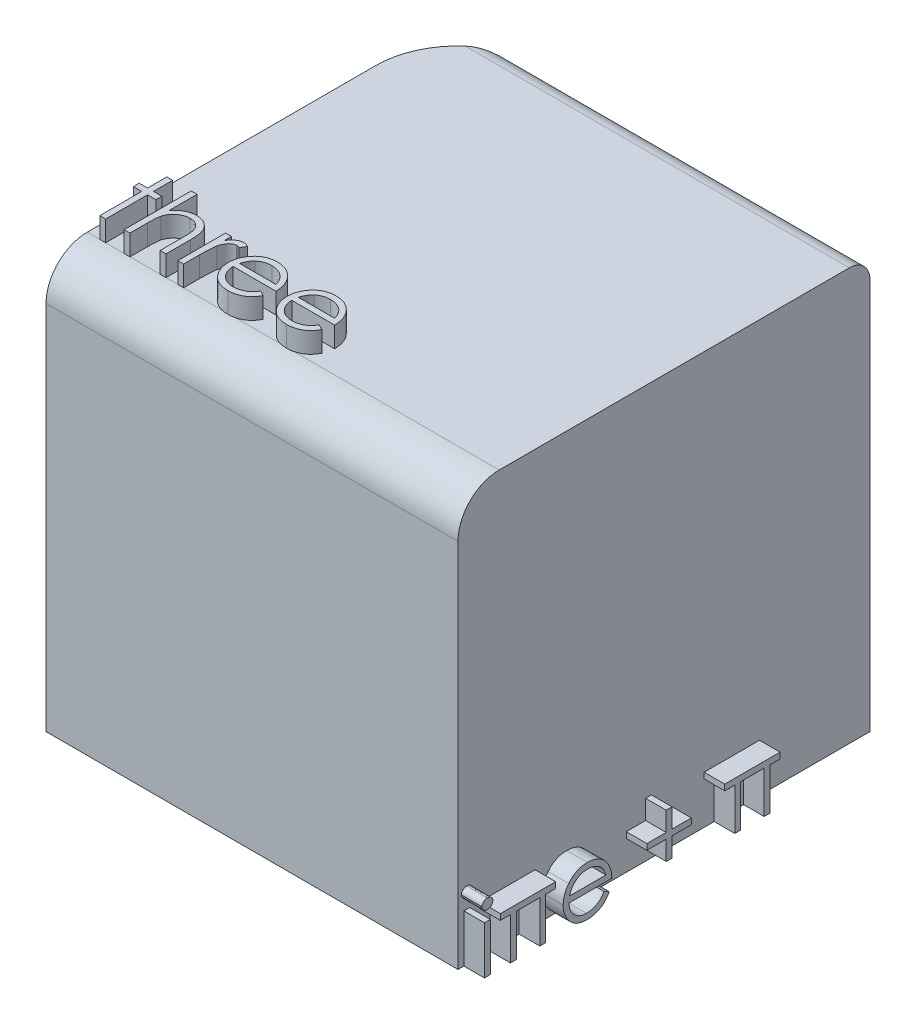
from build123d import *
from OCP.BRepFilletAPI import BRepFilletAPI_MakeFillet

# Parameters (mm, degrees)
SKETCH2_W           = 20
SKETCH2_H           = 20
BOSS_EXTRUDE1_DEPTH = 20
SKETCH3_W           = 0.284935898
SKETCH3_H           = 2.320192308
BOSS_EXTRUDE2_DEPTH = 1
FILLET1_R1          = 2
FILLET1_R2          = 1
FILLET1_R3          = 4
BOSS_EXTRUDE3_DEPTH = 1


with BuildPart() as part:
    # Sketch2 → Boss-Extrude1 (new body)
    with BuildSketch(Plane(origin=(0, 0, 0), x_dir=(1, 0, 0), z_dir=(0, 1, 0))):
        with Locations((10, -10)):
            Rectangle(SKETCH2_W, SKETCH2_H)
    extrude(amount=BOSS_EXTRUDE1_DEPTH)

    # Sketch3 → Boss-Extrude2 (add)
    # profile 1 of 6: a face of its own
    with BuildSketch(Plane(origin=(20, 0, 0), x_dir=(0, 0, -1), z_dir=(1, 0, 0))):
        with BuildLine():
            add(Edge.make_bspline(
                [(-19.573868189, 3.297115385), (-19.556186781, 3.296295189), (-19.521563189, 3.294689089), (-19.47149501, 3.280935463), (-19.425904721, 3.257622177), (-19.385466349, 3.226344181), (-19.350766423, 3.189560043), (-19.326472493, 3.146687593), (-19.310858391, 3.100370114), (-19.308972844, 3.06806214), (-19.308012821, 3.05161258)],
                knots=[0, 0, 0, 0, 1.055194115, 2.066272739, 3.074728998, 4.095836921, 5.109056067, 6.073838105, 7.019297344, 8, 8, 8, 8], degree=3))
            add(Edge.make_bspline(
                [(-19.308012821, 3.05161258), (-19.308994494, 3.03559003), (-19.310935147, 3.003915346), (-19.326460432, 2.958400839), (-19.350973462, 2.916124096), (-19.385444098, 2.879411381), (-19.425910617, 2.848150675), (-19.471493444, 2.824832805), (-19.521563601, 2.811080395), (-19.55618692, 2.809474127), (-19.573868189, 2.808653846)],
                knots=[0, 0, 0, 0, 0.96129708, 1.900370562, 2.859976407, 3.87933698, 4.906634145, 5.921202961, 6.938410037, 8, 8, 8, 8], degree=3))
            add(Edge.make_bspline(
                [(-19.573868189, 2.808653846), (-19.591347267, 2.809442807), (-19.625368009, 2.810978415), (-19.674686502, 2.825102646), (-19.71988806, 2.848158655), (-19.760405299, 2.879206694), (-19.794178403, 2.916349565), (-19.818760455, 2.958375039), (-19.834249885, 3.003921915), (-19.836195369, 3.035592237), (-19.837179487, 3.05161258)],
                knots=[0, 0, 0, 0, 1.054934014, 2.053291228, 3.073705704, 4.106921865, 5.123545215, 6.088680038, 7.033164197, 8, 8, 8, 8], degree=3))
            add(Edge.make_bspline(
                [(-19.837179487, 3.05161258), (-19.83621693, 3.068059851), (-19.834326407, 3.100363328), (-19.818748845, 3.146713822), (-19.794383162, 3.189332756), (-19.760382936, 3.226548745), (-19.719894012, 3.257614247), (-19.674684964, 3.280665637), (-19.625368416, 3.294791066), (-19.591347405, 3.296326509), (-19.573868189, 3.297115385)],
                knots=[0, 0, 0, 0, 0.98631895, 1.937192651, 2.907499808, 3.917963147, 4.944918757, 5.95915025, 6.951458133, 8, 8, 8, 8], degree=3))
        make_face()
    # profile 2 of 6: a face of its own
    with BuildSketch(Plane(origin=(20, 0, 0), x_dir=(0, 0, -1), z_dir=(1, 0, 0))):
        with Locations((-19.572596154, 1.160096154)):
            Rectangle(SKETCH3_W, SKETCH3_H)
    # profile 3 of 6: a face of its own
    with BuildSketch(Plane(origin=(20, 0, 0), x_dir=(0, 0, -1), z_dir=(1, 0, 0))):
        Polygon((-16.256585145, 2.03525641), (-16.745046683, 2.03525641), (-16.745046683, 0), (-17.029982581, 0), (-17.029982581, 2.03525641), (-18.169726171, 2.03525641), (-18.169726171, 0), (-18.454662068, 0), (-18.454662068, 2.03525641), (-18.943123606, 2.03525641), (-18.943123606, 2.320192308), (-16.256585145, 2.320192308), align=None)
    # profile 4 of 6: a face of its own
    with BuildSketch(Plane(origin=(20, 0, 0), x_dir=(0, 0, -1), z_dir=(1, 0, 0))):
        with BuildLine():
            Line((-13.909152811, 0.732692308), (-13.656017795, 0.599764623))
            add(Edge.make_bspline(
                [(-13.656017795, 0.599764623), (-13.676189563, 0.563983887), (-13.715435837, 0.494368744), (-13.782927944, 0.398726985), (-13.853677895, 0.312686557), (-13.930879352, 0.238546085), (-14.012222561, 0.1739109), (-14.098158612, 0.117361587), (-14.189134897, 0.069175501), (-14.285155718, 0.028578565), (-14.387027454, -0.002635762), (-14.494996972, -0.024683162), (-14.609271115, -0.038311413), (-14.687599435, -0.039894505), (-14.727707498, -0.040705128)],
                knots=[0, 0, 0, 0, 1.120438281, 2.179929193, 3.190490725, 4.156257408, 5.095198341, 6.022838206, 6.959905092, 7.901321166, 8.864066838, 9.862729781, 10.905609505, 12, 12, 12, 12], degree=3))
            add(Edge.make_bspline(
                [(-14.727707498, -0.040705128), (-14.772286292, -0.039664476), (-14.859246605, -0.037634466), (-14.985829089, -0.020133445), (-15.10500899, 0.008416481), (-15.216779607, 0.048299508), (-15.320867222, 0.100394295), (-15.417478712, 0.163857539), (-15.507122139, 0.238363227), (-15.586972671, 0.324556715), (-15.658858193, 0.416796776), (-15.722290902, 0.5129139), (-15.775320143, 0.612666254), (-15.818457153, 0.7154188), (-15.853295852, 0.820523904), (-15.877577076, 0.928937878), (-15.891574062, 1.040367301), (-15.893718952, 1.115748455), (-15.894799846, 1.153735978)],
                knots=[0, 0, 0, 0, 1.145258523, 2.234067595, 3.276747158, 4.290159414, 5.277019952, 6.260822364, 7.254936242, 8.264827045, 9.274100331, 10.257902744, 11.220704747, 12.172965371, 13.118907548, 14.062713208, 15.023725156, 16, 16, 16, 16], degree=3))
            add(Edge.make_bspline(
                [(-15.894799846, 1.153735978), (-15.893839054, 1.189382002), (-15.89193489, 1.260027716), (-15.879932675, 1.364590031), (-15.858661724, 1.466215842), (-15.829473201, 1.564989591), (-15.791780285, 1.660745898), (-15.745668201, 1.753543042), (-15.691065115, 1.843282276), (-15.648907761, 1.899890833), (-15.627672442, 1.928405449)],
                knots=[0, 0, 0, 0, 1.024358464, 2.0301432, 3.019427413, 4.004406732, 4.986367066, 5.972626655, 6.978780325, 8, 8, 8, 8], degree=3))
            add(Edge.make_bspline(
                [(-15.627672442, 1.928405449), (-15.598909044, 1.962757924), (-15.5422934, 2.030374674), (-15.446538706, 2.119218727), (-15.342852099, 2.193644152), (-15.232532981, 2.25533634), (-15.11429918, 2.302211719), (-14.989740037, 2.337143598), (-14.857437256, 2.356717936), (-14.766990377, 2.359482757), (-14.720711304, 2.360897436)],
                knots=[0, 0, 0, 0, 1.030682036, 2.02871468, 2.997146059, 3.962720338, 4.930598197, 5.918074684, 6.934738563, 8, 8, 8, 8], degree=3))
            add(Edge.make_bspline(
                [(-14.720711304, 2.360897436), (-14.673133834, 2.35966912), (-14.579797682, 2.357259445), (-14.443697115, 2.334919842), (-14.314918465, 2.299493596), (-14.193513265, 2.249461229), (-14.079469206, 2.18490935), (-13.973527575, 2.104952108), (-13.87387656, 2.012044272), (-13.815902349, 1.940594789), (-13.786401409, 1.904236779)],
                knots=[0, 0, 0, 0, 1.056321875, 2.072262726, 3.055038591, 4.01806755, 4.982017516, 5.957941055, 6.960871419, 8, 8, 8, 8], degree=3))
            add(Edge.make_bspline(
                [(-13.786401409, 1.904236779), (-13.766329115, 1.876837816), (-13.726318134, 1.822222265), (-13.676201121, 1.733167001), (-13.632696913, 1.639993819), (-13.597923441, 1.541196621), (-13.56976618, 1.437946002), (-13.549394637, 1.329503836), (-13.537447911, 1.215902417), (-13.535099593, 1.138499042), (-13.53390241, 1.099038462)],
                knots=[0, 0, 0, 0, 0.94817472, 1.890038105, 2.849395472, 3.817997239, 4.812318967, 5.836947057, 6.897266129, 8, 8, 8, 8], degree=3))
            Line((-13.53390241, 1.099038462), (-15.609863949, 1.099038462))
            add(Edge.make_bspline(
                [(-15.609863949, 1.099038462), (-15.608467306, 1.068467326), (-15.605720864, 1.008350421), (-15.592916412, 0.920384068), (-15.572733596, 0.836588251), (-15.544368089, 0.757591491), (-15.510017451, 0.682362018), (-15.467938979, 0.611457885), (-15.417738098, 0.545202048), (-15.361744071, 0.483001859), (-15.29941692, 0.427611026), (-15.233846142, 0.378034057), (-15.164092694, 0.336481837), (-15.090706576, 0.302754366), (-15.013806456, 0.276350779), (-14.933368108, 0.258327828), (-14.849549816, 0.246256381), (-14.792412758, 0.244914113), (-14.763324485, 0.244230769)],
                knots=[0, 0, 0, 0, 1.094153842, 2.151609401, 3.174256925, 4.172055639, 5.149267565, 6.128595816, 7.11444997, 8.118368179, 9.117203808, 10.09244225, 11.054858984, 12.015122123, 12.976791628, 13.957293641, 14.960065497, 16, 16, 16, 16], degree=3))
            add(Edge.make_bspline(
                [(-14.763324485, 0.244230769), (-14.734884516, 0.244782363), (-14.678454161, 0.245876832), (-14.594415669, 0.256519351), (-14.511739097, 0.273728102), (-14.430766634, 0.297214021), (-14.353141652, 0.325858737), (-14.281254617, 0.360423472), (-14.21514185, 0.398659314), (-14.153350031, 0.442392376), (-14.093414201, 0.495921231), (-14.033957803, 0.56271935), (-13.970206839, 0.641720179), (-13.930301994, 0.701179461), (-13.909152811, 0.732692308)],
                knots=[0, 0, 0, 0, 0.99110716, 1.966546729, 2.947904876, 3.932708344, 4.903319531, 5.828989031, 6.710028674, 7.56322171, 8.463672341, 9.504779593, 10.677557249, 12, 12, 12, 12], degree=3))
        make_face()
        with BuildLine():
            add(Edge.make_bspline(
                [(-13.818838308, 1.383974359), (-13.829267388, 1.421768537), (-13.849340012, 1.494510165), (-13.891283, 1.595240115), (-13.938519326, 1.68476414), (-13.994419039, 1.762397092), (-14.057754598, 1.831343136), (-14.130911299, 1.891594282), (-14.212949574, 1.945494398), (-14.303445366, 1.990989879), (-14.399277556, 2.02971568), (-14.499613173, 2.055682749), (-14.60199131, 2.073471405), (-14.671237412, 2.075127947), (-14.706082899, 2.075961538)],
                knots=[0, 0, 0, 0, 1.154881502, 2.222775134, 3.210006277, 4.132804581, 5.035138423, 5.962687519, 6.919655026, 7.923214229, 8.944639381, 9.960483929, 10.97369054, 12, 12, 12, 12], degree=3))
            add(Edge.make_bspline(
                [(-14.706082899, 2.075961538), (-14.734521318, 2.075406665), (-14.790738094, 2.074309797), (-14.873561206, 2.063904751), (-14.953099219, 2.046705463), (-15.029939015, 2.023151538), (-15.10307366, 1.991756592), (-15.174007485, 1.954941807), (-15.240936845, 1.910000514), (-15.282793592, 1.875747838), (-15.303939469, 1.85844351)],
                knots=[0, 0, 0, 0, 1.04873581, 2.073130211, 3.073294108, 4.04793562, 5.032784715, 6.005352987, 6.992311501, 8, 8, 8, 8], degree=3))
            add(Edge.make_bspline(
                [(-15.303939469, 1.85844351), (-15.319082661, 1.844750809), (-15.34972879, 1.81704012), (-15.390677691, 1.769297911), (-15.429884835, 1.717816137), (-15.465566077, 1.660625203), (-15.498293602, 1.598376353), (-15.528918724, 1.531594641), (-15.55648354, 1.459773302), (-15.571992154, 1.409724017), (-15.57997112, 1.383974359)],
                knots=[0, 0, 0, 0, 0.879870761, 1.780643979, 2.707998968, 3.669668524, 4.684282772, 5.740141944, 6.837334558, 8, 8, 8, 8], degree=3))
            Line((-15.57997112, 1.383974359), (-13.818838308, 1.383974359))
        make_face(mode=Mode.SUBTRACT)
    # profile 5 of 6: a face of its own
    with BuildSketch(Plane(origin=(20, 0, 0), x_dir=(0, 0, -1), z_dir=(1, 0, 0))):
        Polygon((-10.894403598, 1.709615385), (-10.894403598, 2.645833333), (-10.6094677, 2.645833333), (-10.6094677, 1.709615385), (-9.673249751, 1.709615385), (-9.673249751, 1.424679487), (-10.6094677, 1.424679487), (-10.6094677, 0.488461538), (-10.894403598, 0.488461538), (-10.894403598, 1.424679487), (-11.830621546, 1.424679487), (-11.830621546, 1.709615385), align=None)
    # profile 6 of 6: a face of its own
    with BuildSketch(Plane(origin=(20, 0, 0), x_dir=(0, 0, -1), z_dir=(1, 0, 0))):
        Polygon((-5.364587302, 2.03525641), (-5.85304884, 2.03525641), (-5.85304884, 0), (-6.137984738, 0), (-6.137984738, 2.03525641), (-7.277728327, 2.03525641), (-7.277728327, 0), (-7.562664225, 0), (-7.562664225, 2.03525641), (-8.051125763, 2.03525641), (-8.051125763, 2.320192308), (-5.364587302, 2.320192308), align=None)
    extrude(amount=BOSS_EXTRUDE2_DEPTH)

    # Fillet1: one fillet with a radius per group of edges: ONE call of the kernel's fillet builder (fillet() takes one radius for all edges)
    fillet1_edges_1 = [part.edges().sort_by_distance(p)[0] for p in [
        (10, 20, 20),
    ]]
    fillet1_edges_2 = [part.edges().sort_by_distance(p)[0] for p in [
        (10, 20, 0),
    ]]
    fillet1_edges_3 = [part.edges().sort_by_distance(p)[0] for p in [
        (0, 10, 0),
    ]]
    fillet1 = BRepFilletAPI_MakeFillet(part.part.solid().wrapped)
    for e in fillet1_edges_1:
        fillet1.Add(FILLET1_R1, e.wrapped)
    for e in fillet1_edges_2:
        fillet1.Add(FILLET1_R2, e.wrapped)
    for e in fillet1_edges_3:
        fillet1.Add(FILLET1_R3, e.wrapped)
    add(Compound.cast(fillet1.Shape()), mode=Mode.REPLACE)

    # Sketch4 → Boss-Extrude3 (add)
    # profile 1 of 5: a face of its own
    with BuildSketch(Plane(origin=(0, 20, 0), x_dir=(1, 0, 0), z_dir=(0, 1, 0))):
        Polygon((0.610576923, -14.743589744), (0.895512821, -14.743589744), (0.895512821, -15.679807692), (1.302564103, -15.679807692), (1.302564103, -15.96474359), (0.895512821, -15.96474359), (0.895512821, -18), (0.610576923, -18), (0.610576923, -15.96474359), (0.203525641, -15.96474359), (0.203525641, -15.679807692), (0.610576923, -15.679807692), align=None)
    # profile 2 of 5: a face of its own
    with BuildSketch(Plane(origin=(0, 20, 0), x_dir=(1, 0, 0), z_dir=(0, 1, 0))):
        with BuildLine():
            Line((1.791025641, -14.743589744), (2.075961538, -14.743589744))
            Line((2.075961538, -14.743589744), (2.075961538, -16.118023838))
            add(Edge.make_bspline(
                [(2.075961538, -16.118023838), (2.106547948, -16.079793226), (2.166101254, -16.005356265), (2.266337017, -15.90823647), (2.369271308, -15.824054864), (2.478459386, -15.757043806), (2.591898072, -15.704106085), (2.710065807, -15.666561577), (2.832984545, -15.643473796), (2.916464502, -15.640572374), (2.958754006, -15.639102564)],
                knots=[0, 0, 0, 0, 1.125788106, 2.19196713, 3.20547328, 4.180437432, 5.132270164, 6.079753143, 7.027236121, 8, 8, 8, 8], degree=3))
            add(Edge.make_bspline(
                [(2.958754006, -15.639102564), (3.001689434, -15.640685919), (3.085724423, -15.643784926), (3.208081178, -15.668289921), (3.322345686, -15.710161311), (3.428178272, -15.767462827), (3.523269248, -15.83883032), (3.607497248, -15.921227487), (3.676295687, -16.01672597), (3.723103457, -16.104951286), (3.753559334, -16.183454299), (3.772837777, -16.250797421), (3.789183764, -16.325838013), (3.803425667, -16.408537449), (3.81291763, -16.499292712), (3.82054182, -16.597694357), (3.825963317, -16.703736743), (3.826173416, -16.777142969), (3.826282051, -16.815099159)],
                knots=[0, 0, 0, 0, 1.235656852, 2.418478516, 3.575258207, 4.727955599, 5.870717718, 6.98870536, 8.107142894, 9.245821548, 9.854588956, 10.528768408, 11.260415777, 12.065282286, 12.943670737, 13.886611085, 14.907229059, 16, 16, 16, 16], degree=3))
            Line((3.826282051, -16.815099159), (3.826282051, -18))
            Line((3.826282051, -18), (3.541346154, -18))
            Line((3.541346154, -18), (3.541346154, -16.90859375))
            add(Edge.make_bspline(
                [(3.541346154, -16.90859375), (3.541173522, -16.877004614), (3.540843306, -16.816579973), (3.5397517, -16.730069289), (3.537314919, -16.651604938), (3.53337717, -16.581438389), (3.529235784, -16.519471821), (3.523535918, -16.465795221), (3.516904491, -16.420334868), (3.510945668, -16.392971241), (3.508273237, -16.380699119)],
                knots=[0, 0, 0, 0, 1.430932559, 2.737130458, 3.918967929, 4.986496826, 5.920444988, 6.731744033, 7.431208747, 8, 8, 8, 8], degree=3))
            add(Edge.make_bspline(
                [(3.508273237, -16.380699119), (3.497909815, -16.344690751), (3.477986196, -16.275464874), (3.431678388, -16.181428259), (3.373839856, -16.101250672), (3.303221269, -16.03601414), (3.221071896, -15.984840815), (3.126856071, -15.949400755), (3.021460524, -15.927404607), (2.947209546, -15.925191811), (2.908508614, -15.924038462)],
                knots=[0, 0, 0, 0, 1.090059168, 2.095632401, 3.037101401, 3.955032261, 4.878929692, 5.839099886, 6.873700383, 8, 8, 8, 8], degree=3))
            add(Edge.make_bspline(
                [(2.908508614, -15.924038462), (2.885587134, -15.924470104), (2.840226117, -15.925324313), (2.772962685, -15.93390035), (2.707712748, -15.947914544), (2.643847916, -15.966877947), (2.582721729, -15.992682113), (2.522552463, -16.022554499), (2.465044859, -16.059119844), (2.409177725, -16.100146076), (2.357182534, -16.145566501), (2.308807222, -16.193506239), (2.265683157, -16.244555671), (2.226613792, -16.297895776), (2.192887776, -16.354258189), (2.163448194, -16.413099392), (2.138469384, -16.474496767), (2.126057227, -16.517109858), (2.119846755, -16.53843149)],
                knots=[0, 0, 0, 0, 1.024319606, 2.027102035, 3.025350316, 4.005802111, 5.00026367, 5.987881639, 7.005602596, 8.042517216, 9.083927026, 10.089214625, 11.084353441, 12.06828073, 13.041928858, 14.016821737, 15.00770877, 16, 16, 16, 16], degree=3))
            add(Edge.make_bspline(
                [(2.119846755, -16.53843149), (2.116273132, -16.553871924), (2.108485767, -16.587518531), (2.100035882, -16.643012382), (2.092472309, -16.707497876), (2.086078268, -16.780877207), (2.082156611, -16.863419262), (2.077930921, -16.954560775), (2.076357923, -17.054872651), (2.076097615, -17.124627861), (2.075961538, -17.161092748)],
                knots=[0, 0, 0, 0, 0.607992626, 1.324890765, 2.152360218, 3.099583803, 4.150613268, 5.323148443, 6.60066238, 8, 8, 8, 8], degree=3))
            Line((2.075961538, -17.161092748), (2.075961538, -18))
            Line((2.075961538, -18), (1.791025641, -18))
            Line((1.791025641, -18), (1.791025641, -14.743589744))
        make_face()
    # profile 3 of 5: a face of its own
    with BuildSketch(Plane(origin=(0, 20, 0), x_dir=(1, 0, 0), z_dir=(0, 1, 0))):
        with BuildLine():
            Line((4.396153846, -15.679807692), (4.681089744, -15.679807692))
            Line((4.681089744, -15.679807692), (4.681089744, -16.021349159))
            add(Edge.make_bspline(
                [(4.681089744, -16.021349159), (4.70212526, -15.989548514), (4.742355523, -15.928730029), (4.80922368, -15.848294306), (4.877715988, -15.781696371), (4.948160337, -15.728625322), (5.021074756, -15.688880564), (5.09485899, -15.659767597), (5.170673881, -15.642552461), (5.221620769, -15.64025407), (5.247145433, -15.639102564)],
                knots=[0, 0, 0, 0, 1.2804753, 2.448899062, 3.506932113, 4.484331642, 5.4025378, 6.288909075, 7.142734305, 8, 8, 8, 8], degree=3))
            add(Edge.make_bspline(
                [(5.247145433, -15.639102564), (5.266945029, -15.640182542), (5.307683985, -15.642404666), (5.369353905, -15.658017343), (5.432893323, -15.682943835), (5.473843917, -15.706384608), (5.495192308, -15.718604768)],
                knots=[0, 0, 0, 0, 0.901110191, 1.854092781, 2.881294221, 4, 4, 4, 4], degree=3))
            Line((5.495192308, -15.718604768), (5.338731971, -15.965379607))
            add(Edge.make_bspline(
                [(5.338731971, -15.965379607), (5.325025931, -15.959265223), (5.299009242, -15.947658951), (5.260950457, -15.933922985), (5.225860958, -15.925834976), (5.20350573, -15.924609682), (5.193083934, -15.924038462)],
                knots=[0, 0, 0, 0, 1.180555205, 2.24091978, 3.179933427, 4, 4, 4, 4], degree=3))
            add(Edge.make_bspline(
                [(5.193083934, -15.924038462), (5.170218733, -15.925562495), (5.123580351, -15.928671083), (5.055105126, -15.95310843), (4.988659447, -15.992592041), (4.935889439, -16.036380835), (4.895029681, -16.078606337), (4.865873905, -16.115480245), (4.839128842, -16.156826575), (4.813574428, -16.201938502), (4.790291432, -16.251586291), (4.768561125, -16.305273921), (4.748913442, -16.363063573), (4.737710006, -16.403324859), (4.731971154, -16.423948317)],
                knots=[0, 0, 0, 0, 1.125678352, 2.296057538, 3.5422874, 4.923748041, 5.663163013, 6.437101912, 7.23742474, 8.08941207, 8.991984279, 9.93940061, 10.944477711, 12, 12, 12, 12], degree=3))
            add(Edge.make_bspline(
                [(4.731971154, -16.423948317), (4.727678197, -16.44234261), (4.718169624, -16.483084572), (4.708924443, -16.551436448), (4.699789952, -16.632193624), (4.693352305, -16.725580891), (4.687385081, -16.831365036), (4.684019507, -16.949707215), (4.681204515, -17.080728898), (4.681129161, -17.172327062), (4.681089744, -17.220242388)],
                knots=[0, 0, 0, 0, 0.566838948, 1.255505196, 2.06880316, 3.007127437, 4.065329342, 5.249902469, 6.561414163, 8, 8, 8, 8], degree=3))
            Line((4.681089744, -17.220242388), (4.681089744, -18))
            Line((4.681089744, -18), (4.396153846, -18))
            Line((4.396153846, -18), (4.396153846, -15.679807692))
        make_face()
    # profile 4 of 5: a face of its own
    with BuildSketch(Plane(origin=(0, 20, 0), x_dir=(1, 0, 0), z_dir=(0, 1, 0))):
        with BuildLine():
            Line((7.684364984, -17.267307692), (7.9375, -17.400235377))
            add(Edge.make_bspline(
                [(7.9375, -17.400235377), (7.917328231, -17.436016113), (7.878081958, -17.505631256), (7.810589851, -17.601273015), (7.739839899, -17.687313443), (7.662638443, -17.761453915), (7.581295234, -17.8260891), (7.495359183, -17.882638413), (7.404382898, -17.930824499), (7.308362076, -17.971421435), (7.206490341, -18.002635762), (7.098520822, -18.024683162), (6.98424668, -18.038311413), (6.90591836, -18.039894505), (6.865810296, -18.040705128)],
                knots=[0, 0, 0, 0, 1.120438281, 2.179929193, 3.190490725, 4.156257408, 5.095198341, 6.022838206, 6.959905092, 7.901321166, 8.864066838, 9.862729781, 10.905609505, 12, 12, 12, 12], degree=3))
            add(Edge.make_bspline(
                [(6.865810296, -18.040705128), (6.821231503, -18.039664476), (6.73427119, -18.037634466), (6.607688705, -18.020133445), (6.488508804, -17.991583519), (6.376738188, -17.951700492), (6.272650573, -17.899605705), (6.176039083, -17.836142461), (6.086395656, -17.761636773), (6.006545124, -17.675443285), (5.934659601, -17.583203224), (5.871226893, -17.4870861), (5.818197652, -17.387333746), (5.775060642, -17.2845812), (5.740221943, -17.179476096), (5.715940718, -17.071062122), (5.701943733, -16.959632699), (5.699798843, -16.884251545), (5.698717949, -16.846264022)],
                knots=[0, 0, 0, 0, 1.145258523, 2.234067595, 3.276747158, 4.290159414, 5.277019952, 6.260822364, 7.254936242, 8.264827045, 9.274100331, 10.257902744, 11.220704747, 12.172965371, 13.118907548, 14.062713208, 15.023725156, 16, 16, 16, 16], degree=3))
            add(Edge.make_bspline(
                [(5.698717949, -16.846264022), (5.699678741, -16.810617998), (5.701582905, -16.739972284), (5.713585119, -16.635409969), (5.734856071, -16.533784158), (5.764044593, -16.435010409), (5.80173751, -16.339254102), (5.847849594, -16.246456958), (5.90245268, -16.156717724), (5.944610034, -16.100109167), (5.965845353, -16.071594551)],
                knots=[0, 0, 0, 0, 1.024358464, 2.0301432, 3.019427413, 4.004406732, 4.986367066, 5.972626655, 6.978780325, 8, 8, 8, 8], degree=3))
            add(Edge.make_bspline(
                [(5.965845353, -16.071594551), (5.994608751, -16.037242076), (6.051224395, -15.969625326), (6.146979089, -15.880781273), (6.250665695, -15.806355848), (6.360984813, -15.74466366), (6.479218615, -15.697788281), (6.603777757, -15.662856402), (6.736080539, -15.643282064), (6.826527418, -15.640517243), (6.87280649, -15.639102564)],
                knots=[0, 0, 0, 0, 1.030682036, 2.02871468, 2.997146059, 3.962720338, 4.930598197, 5.918074684, 6.934738563, 8, 8, 8, 8], degree=3))
            add(Edge.make_bspline(
                [(6.87280649, -15.639102564), (6.920383961, -15.64033088), (7.013720113, -15.642740555), (7.14982068, -15.665080158), (7.27859933, -15.700506404), (7.40000453, -15.750538771), (7.514048589, -15.81509065), (7.61999022, -15.895047892), (7.719641235, -15.987955728), (7.777615446, -16.059405211), (7.807116386, -16.095763221)],
                knots=[0, 0, 0, 0, 1.056321875, 2.072262726, 3.055038591, 4.01806755, 4.982017516, 5.957941055, 6.960871419, 8, 8, 8, 8], degree=3))
            add(Edge.make_bspline(
                [(7.807116386, -16.095763221), (7.82718868, -16.123162184), (7.867199661, -16.177777735), (7.917316673, -16.266832999), (7.960820882, -16.360006181), (7.995594353, -16.458803379), (8.023751615, -16.562053998), (8.044123158, -16.670496164), (8.056069883, -16.784097583), (8.058418202, -16.861500958), (8.059615385, -16.900961538)],
                knots=[0, 0, 0, 0, 0.94817472, 1.890038105, 2.849395472, 3.817997239, 4.812318967, 5.836947057, 6.897266129, 8, 8, 8, 8], degree=3))
            Line((8.059615385, -16.900961538), (5.983653846, -16.900961538))
            add(Edge.make_bspline(
                [(5.983653846, -16.900961538), (5.985050489, -16.931532674), (5.987796931, -16.991649579), (6.000601383, -17.079615932), (6.020784199, -17.163411749), (6.049149706, -17.242408509), (6.083500344, -17.317637982), (6.125578815, -17.388542115), (6.175779696, -17.454797952), (6.231773724, -17.516998141), (6.294100875, -17.572388974), (6.359671652, -17.621965943), (6.429425101, -17.663518163), (6.502811219, -17.697245634), (6.579711339, -17.723649221), (6.660149687, -17.741672172), (6.743967978, -17.753743619), (6.801105037, -17.755085887), (6.830193309, -17.755769231)],
                knots=[0, 0, 0, 0, 1.094153842, 2.151609401, 3.174256925, 4.172055639, 5.149267565, 6.128595816, 7.11444997, 8.118368179, 9.117203808, 10.09244225, 11.054858984, 12.015122123, 12.976791628, 13.957293641, 14.960065497, 16, 16, 16, 16], degree=3))
            add(Edge.make_bspline(
                [(6.830193309, -17.755769231), (6.858633279, -17.755217637), (6.915063634, -17.754123168), (6.999102126, -17.743480649), (7.081778698, -17.726271898), (7.162751161, -17.702785979), (7.240376143, -17.674141263), (7.312263177, -17.639576528), (7.378375944, -17.601340686), (7.440167764, -17.557607624), (7.500103594, -17.504078769), (7.559559992, -17.43728065), (7.623310956, -17.358279821), (7.663215801, -17.298820539), (7.684364984, -17.267307692)],
                knots=[0, 0, 0, 0, 0.99110716, 1.966546729, 2.947904876, 3.932708344, 4.903319531, 5.828989031, 6.710028674, 7.56322171, 8.463672341, 9.504779593, 10.677557249, 12, 12, 12, 12], degree=3))
        make_face()
        with BuildLine():
            add(Edge.make_bspline(
                [(7.774679487, -16.616025641), (7.764250406, -16.578231463), (7.744177783, -16.505489835), (7.702234795, -16.404759885), (7.654998469, -16.31523586), (7.599098755, -16.237602908), (7.535763197, -16.168656864), (7.462606496, -16.108405718), (7.380568221, -16.054505602), (7.290072429, -16.009010121), (7.194240238, -15.97028432), (7.093904621, -15.944317251), (6.991526485, -15.926528595), (6.922280383, -15.924872053), (6.887434896, -15.924038462)],
                knots=[0, 0, 0, 0, 1.154881502, 2.222775134, 3.210006277, 4.132804581, 5.035138423, 5.962687519, 6.919655026, 7.923214229, 8.944639381, 9.960483929, 10.97369054, 12, 12, 12, 12], degree=3))
            add(Edge.make_bspline(
                [(6.887434896, -15.924038462), (6.858996477, -15.924593335), (6.802779701, -15.925690203), (6.719956589, -15.936095249), (6.640418576, -15.953294537), (6.56357878, -15.976848462), (6.490444135, -16.008243408), (6.419510309, -16.045058193), (6.35258095, -16.089999486), (6.310724203, -16.124252162), (6.289578325, -16.14155649)],
                knots=[0, 0, 0, 0, 1.04873581, 2.073130211, 3.073294108, 4.04793562, 5.032784715, 6.005352987, 6.992311501, 8, 8, 8, 8], degree=3))
            add(Edge.make_bspline(
                [(6.289578325, -16.14155649), (6.274435134, -16.155249191), (6.243789005, -16.18295988), (6.202840103, -16.230702089), (6.16363296, -16.282183863), (6.127951718, -16.339374797), (6.095224193, -16.401623647), (6.064599071, -16.468405359), (6.037034254, -16.540226698), (6.02152564, -16.590275983), (6.013546675, -16.616025641)],
                knots=[0, 0, 0, 0, 0.879870761, 1.780643979, 2.707998968, 3.669668524, 4.684282772, 5.740141944, 6.837334558, 8, 8, 8, 8], degree=3))
            Line((6.013546675, -16.616025641), (7.774679487, -16.616025641))
        make_face(mode=Mode.SUBTRACT)
    # profile 5 of 5: a face of its own
    with BuildSketch(Plane(origin=(0, 20, 0), x_dir=(1, 0, 0), z_dir=(0, 1, 0))):
        with BuildLine():
            Line((10.533723958, -17.267307692), (10.786858974, -17.400235377))
            add(Edge.make_bspline(
                [(10.786858974, -17.400235377), (10.766687206, -17.436016113), (10.727440932, -17.505631256), (10.659948825, -17.601273015), (10.589198874, -17.687313443), (10.511997417, -17.761453915), (10.430654208, -17.8260891), (10.344718157, -17.882638413), (10.253741873, -17.930824499), (10.157721051, -17.971421435), (10.055849315, -18.002635762), (9.947879797, -18.024683162), (9.833605654, -18.038311413), (9.755277334, -18.039894505), (9.715169271, -18.040705128)],
                knots=[0, 0, 0, 0, 1.120438281, 2.179929193, 3.190490725, 4.156257408, 5.095198341, 6.022838206, 6.959905092, 7.901321166, 8.864066838, 9.862729781, 10.905609505, 12, 12, 12, 12], degree=3))
            add(Edge.make_bspline(
                [(9.715169271, -18.040705128), (9.670590477, -18.039664476), (9.583630165, -18.037634466), (9.45704768, -18.020133445), (9.337867779, -17.991583519), (9.226097162, -17.951700492), (9.122009547, -17.899605705), (9.025398058, -17.836142461), (8.93575463, -17.761636773), (8.855904098, -17.675443285), (8.784018576, -17.583203224), (8.720585868, -17.4870861), (8.667556627, -17.387333746), (8.624419616, -17.2845812), (8.589580917, -17.179476096), (8.565299693, -17.071062122), (8.551302707, -16.959632699), (8.549157817, -16.884251545), (8.548076923, -16.846264022)],
                knots=[0, 0, 0, 0, 1.145258523, 2.234067595, 3.276747158, 4.290159414, 5.277019952, 6.260822364, 7.254936242, 8.264827045, 9.274100331, 10.257902744, 11.220704747, 12.172965371, 13.118907548, 14.062713208, 15.023725156, 16, 16, 16, 16], degree=3))
            add(Edge.make_bspline(
                [(8.548076923, -16.846264022), (8.549037716, -16.810617998), (8.550941879, -16.739972284), (8.562944094, -16.635409969), (8.584215045, -16.533784158), (8.613403568, -16.435010409), (8.651096484, -16.339254102), (8.697208568, -16.246456958), (8.751811654, -16.156717724), (8.793969008, -16.100109167), (8.815204327, -16.071594551)],
                knots=[0, 0, 0, 0, 1.024358464, 2.0301432, 3.019427413, 4.004406732, 4.986367066, 5.972626655, 6.978780325, 8, 8, 8, 8], degree=3))
            add(Edge.make_bspline(
                [(8.815204327, -16.071594551), (8.843967725, -16.037242076), (8.900583369, -15.969625326), (8.996338063, -15.880781273), (9.10002467, -15.806355848), (9.210343788, -15.74466366), (9.328577589, -15.697788281), (9.453136732, -15.662856402), (9.585439514, -15.643282064), (9.675886392, -15.640517243), (9.722165465, -15.639102564)],
                knots=[0, 0, 0, 0, 1.030682036, 2.02871468, 2.997146059, 3.962720338, 4.930598197, 5.918074684, 6.934738563, 8, 8, 8, 8], degree=3))
            add(Edge.make_bspline(
                [(9.722165465, -15.639102564), (9.769742935, -15.64033088), (9.863079087, -15.642740555), (9.999179654, -15.665080158), (10.127958304, -15.700506404), (10.249363504, -15.750538771), (10.363407564, -15.81509065), (10.469349194, -15.895047892), (10.569000209, -15.987955728), (10.62697442, -16.059405211), (10.656475361, -16.095763221)],
                knots=[0, 0, 0, 0, 1.056321875, 2.072262726, 3.055038591, 4.01806755, 4.982017516, 5.957941055, 6.960871419, 8, 8, 8, 8], degree=3))
            add(Edge.make_bspline(
                [(10.656475361, -16.095763221), (10.676547655, -16.123162184), (10.716558635, -16.177777735), (10.766675648, -16.266832999), (10.810179856, -16.360006181), (10.844953328, -16.458803379), (10.87311059, -16.562053998), (10.893482132, -16.670496164), (10.905428858, -16.784097583), (10.907777176, -16.861500958), (10.908974359, -16.900961538)],
                knots=[0, 0, 0, 0, 0.94817472, 1.890038105, 2.849395472, 3.817997239, 4.812318967, 5.836947057, 6.897266129, 8, 8, 8, 8], degree=3))
            Line((10.908974359, -16.900961538), (8.833012821, -16.900961538))
            add(Edge.make_bspline(
                [(8.833012821, -16.900961538), (8.834409463, -16.931532674), (8.837155906, -16.991649579), (8.849960357, -17.079615932), (8.870143173, -17.163411749), (8.89850868, -17.242408509), (8.932859318, -17.317637982), (8.97493779, -17.388542115), (9.025138671, -17.454797952), (9.081132698, -17.516998141), (9.143459849, -17.572388974), (9.209030627, -17.621965943), (9.278784075, -17.663518163), (9.352170194, -17.697245634), (9.429070313, -17.723649221), (9.509508661, -17.741672172), (9.593326953, -17.753743619), (9.650464011, -17.755085887), (9.679552284, -17.755769231)],
                knots=[0, 0, 0, 0, 1.094153842, 2.151609401, 3.174256925, 4.172055639, 5.149267565, 6.128595816, 7.11444997, 8.118368179, 9.117203808, 10.09244225, 11.054858984, 12.015122123, 12.976791628, 13.957293641, 14.960065497, 16, 16, 16, 16], degree=3))
            add(Edge.make_bspline(
                [(9.679552284, -17.755769231), (9.707992253, -17.755217637), (9.764422609, -17.754123168), (9.848461101, -17.743480649), (9.931137672, -17.726271898), (10.012110135, -17.702785979), (10.089735117, -17.674141263), (10.161622152, -17.639576528), (10.227734919, -17.601340686), (10.289526738, -17.557607624), (10.349462568, -17.504078769), (10.408918966, -17.43728065), (10.472669931, -17.358279821), (10.512574775, -17.298820539), (10.533723958, -17.267307692)],
                knots=[0, 0, 0, 0, 0.99110716, 1.966546729, 2.947904876, 3.932708344, 4.903319531, 5.828989031, 6.710028674, 7.56322171, 8.463672341, 9.504779593, 10.677557249, 12, 12, 12, 12], degree=3))
        make_face()
        with BuildLine():
            add(Edge.make_bspline(
                [(10.624038462, -16.616025641), (10.613609381, -16.578231463), (10.593536757, -16.505489835), (10.551593769, -16.404759885), (10.504357443, -16.31523586), (10.44845773, -16.237602908), (10.385122172, -16.168656864), (10.31196547, -16.108405718), (10.229927195, -16.054505602), (10.139431403, -16.009010121), (10.043599213, -15.97028432), (9.943263596, -15.944317251), (9.84088546, -15.926528595), (9.771639357, -15.924872053), (9.73679387, -15.924038462)],
                knots=[0, 0, 0, 0, 1.154881502, 2.222775134, 3.210006277, 4.132804581, 5.035138423, 5.962687519, 6.919655026, 7.923214229, 8.944639381, 9.960483929, 10.97369054, 12, 12, 12, 12], degree=3))
            add(Edge.make_bspline(
                [(9.73679387, -15.924038462), (9.708355451, -15.924593335), (9.652138675, -15.925690203), (9.569315563, -15.936095249), (9.489777551, -15.953294537), (9.412937754, -15.976848462), (9.339803109, -16.008243408), (9.268869284, -16.045058193), (9.201939924, -16.089999486), (9.160083178, -16.124252162), (9.1389373, -16.14155649)],
                knots=[0, 0, 0, 0, 1.04873581, 2.073130211, 3.073294108, 4.04793562, 5.032784715, 6.005352987, 6.992311501, 8, 8, 8, 8], degree=3))
            add(Edge.make_bspline(
                [(9.1389373, -16.14155649), (9.123794108, -16.155249191), (9.093147979, -16.18295988), (9.052199078, -16.230702089), (9.012991935, -16.282183863), (8.977310692, -16.339374797), (8.944583168, -16.401623647), (8.913958045, -16.468405359), (8.886393229, -16.540226698), (8.870884615, -16.590275983), (8.862905649, -16.616025641)],
                knots=[0, 0, 0, 0, 0.879870761, 1.780643979, 2.707998968, 3.669668524, 4.684282772, 5.740141944, 6.837334558, 8, 8, 8, 8], degree=3))
            Line((8.862905649, -16.616025641), (10.624038462, -16.616025641))
        make_face(mode=Mode.SUBTRACT)
    extrude(amount=BOSS_EXTRUDE3_DEPTH)


solid = part.part
